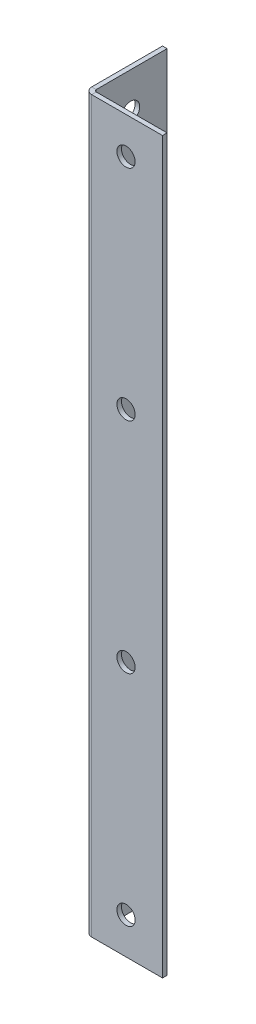
from build123d import *

# Parameters (mm, degrees)
BASE_FLANGE1_DEPTH = 254
SKETCH6_R          = 3.175
CUT_EXTRUDE1_DEPTH = 257.689472235
SKETCH7_R          = 3.175
CUT_EXTRUDE2_DEPTH = 257.689472235


# Sheet-metal steps are written as plain solids
with BuildPart() as part:
    # Sketch1 → Base-Flange1 (new body)
    with BuildSketch(Plane(origin=(0, 0, 0), x_dir=(1, 0, 0), z_dir=(0, 1, 0))):
        with BuildLine():
            Line((0, 25.4), (0, 0.7366))
            ThreePointArc((0, 0.7366), (0.215745145, 0.215745145), (0.7366, 0))
            Line((0.7366, 0), (25.4, 0))
            Line((25.4, 0), (25.4, -1.5875))
            Line((25.4, -1.5875), (0.7366, -1.5875))
            ThreePointArc((0.7366, -1.5875), (-0.90678687, -0.90678687), (-1.5875, 0.7366))
            Line((-1.5875, 0.7366), (-1.5875, 25.4))
            Line((-1.5875, 25.4), (0, 25.4))
        make_face()
    extrude(amount=BASE_FLANGE1_DEPTH)

    # Sketch6 → Cut-Extrude1 (cut, through all)
    with BuildSketch(Plane.XY.offset(1.5875)):
        with Locations((12.7, 241.3)):
            Circle(SKETCH6_R)
        with Locations((12.7, 165.1)):
            Circle(SKETCH6_R)
        with Locations((12.7, 88.9)):
            Circle(SKETCH6_R)
        with Locations((12.7, 12.7)):
            Circle(SKETCH6_R)
    extrude(amount=-CUT_EXTRUDE1_DEPTH, mode=Mode.SUBTRACT)

    # Sketch7 → Cut-Extrude2 (cut, through all)
    with BuildSketch(Plane.ZY.offset(1.5875)):
        with Locations((-12.7, 241.3)):
            Circle(SKETCH7_R)
        with Locations((-12.7, 165.1)):
            Circle(SKETCH7_R)
        with Locations((-12.7, 88.9)):
            Circle(SKETCH7_R)
        with Locations((-12.7, 12.7)):
            Circle(SKETCH7_R)
    extrude(amount=-CUT_EXTRUDE2_DEPTH, mode=Mode.SUBTRACT)


solid = part.part
